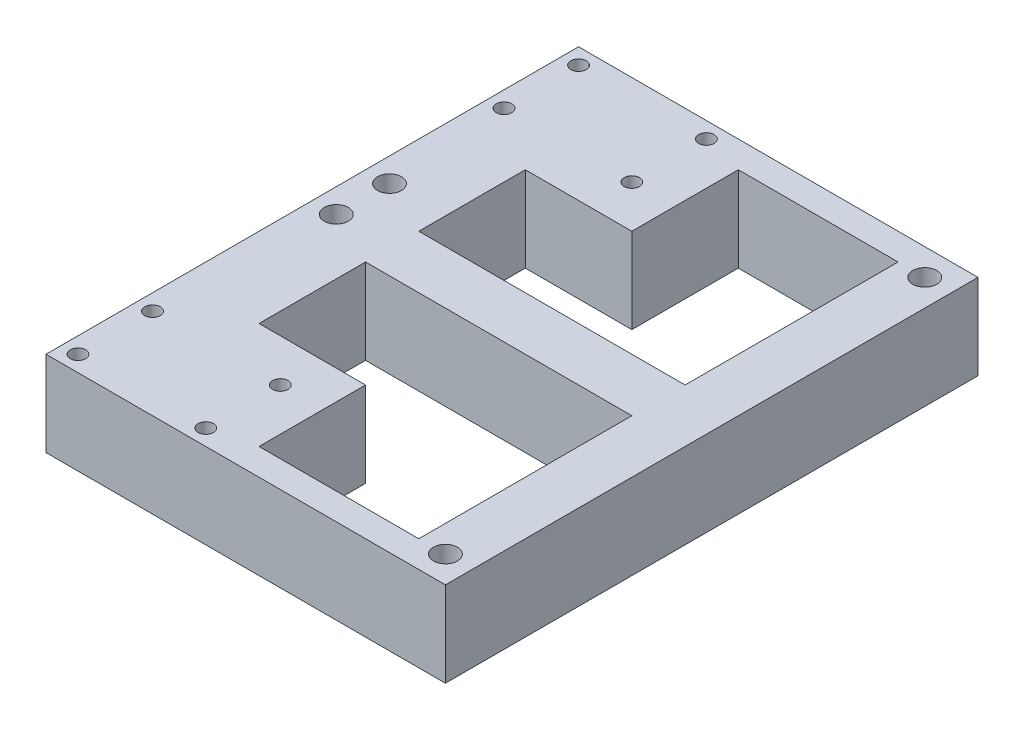
from build123d import *

# Parameters (mm, degrees)
SKETCH_1_W           = 75
SKETCH_1_H           = 100
EXTRUDE_1_DEPTH      = 16
CUT_EXTRUDE_5_REACH  = 128.02
SKETCH_8_R           = 1.45
CUT_EXTRUDE_7_DEPTH  = 127.019839708
SKETCH_9_W           = 40
SKETCH_9_H           = 16
EXTRUDE_2_DEPTH      = 5
SKETCH_10_R          = 2.25
CUT_EXTRUDE_8_DEPTH  = 5
CUT_EXTRUDE_START    = -5
SKETCH_11_R          = 2.25
CUT_EXTRUDE_9_DEPTH  = 5
SKETCH_12_W          = 20
SKETCH_12_H          = 16
EXTRUDE_3_DEPTH      = 10
SKETCH_13_R          = 2.25
CUT_EXTRUDE_10_DEPTH = 5


with BuildPart() as part:
    # 草图1 → 凸台-拉伸1 (new body)
    with BuildSketch(Plane(origin=(0, 0, 0), x_dir=(1, 0, 0), z_dir=(0, 1, 0))):
        with Locations((-37.5, 50)):
            Rectangle(SKETCH_1_W, SKETCH_1_H)
    extrude(amount=EXTRUDE_1_DEPTH)

    # 草图6 → 切除-拉伸5 (cut, up to next)
    with BuildSketch(Plane(origin=(0, 16, 0), x_dir=(1, 0, 0), z_dir=(0, 1, 0)), mode=Mode.PRIVATE) as cut_extrude_5_sk1:
        Polygon((-40, 45), (-5, 45), (-5, 5), (-40, 5), (-40, 25), (-70, 25), (-70, 45), align=None)
    cut_extrude_5_tool1 = extrude(cut_extrude_5_sk1.sketch, amount=-CUT_EXTRUDE_5_REACH, mode=Mode.PRIVATE) & part.part
    # 草图6 → 切除-拉伸5 (cut, up to next)
    with BuildSketch(Plane(origin=(0, 16, 0), x_dir=(1, 0, 0), z_dir=(0, 1, 0)), mode=Mode.PRIVATE) as cut_extrude_5_sk2:
        Polygon((-40, 95), (-5, 95), (-5, 55), (-40, 55), (-70, 55), (-70, 75), (-40, 75), align=None)
    cut_extrude_5_tool2 = extrude(cut_extrude_5_sk2.sketch, amount=-CUT_EXTRUDE_5_REACH, mode=Mode.PRIVATE) & part.part
    add(cut_extrude_5_tool1.solids().sort_by_distance((-32.25, 16, -28))[0], mode=Mode.SUBTRACT)
    add(cut_extrude_5_tool2.solids().sort_by_distance((-32.25, 16, -72))[0], mode=Mode.SUBTRACT)

    # 草图8 → 切除-拉伸7 (cut, through all)
    with BuildSketch(Plane(origin=(0, 16, 0), x_dir=(1, 0, 0), z_dir=(0, 1, 0))):
        with Locations((-72, 97)):
            Circle(SKETCH_8_R)
        with Locations((-72, 83)):
            Circle(SKETCH_8_R)
        with Locations((-48, 97)):
            Circle(SKETCH_8_R)
        with Locations((-48, 83)):
            Circle(SKETCH_8_R)
        with Locations((-48, 17)):
            Circle(SKETCH_8_R)
        with Locations((-48, 3)):
            Circle(SKETCH_8_R)
        with Locations((-72, 17)):
            Circle(SKETCH_8_R)
        with Locations((-72, 3)):
            Circle(SKETCH_8_R)
    extrude(amount=-CUT_EXTRUDE_7_DEPTH, mode=Mode.SUBTRACT)

    # 草图9 → 凸台-拉伸2 (add)
    with BuildSketch(Plane.ZY.offset(5)):
        with Locations((-25, 8)):
            Rectangle(SKETCH_9_W, SKETCH_9_H)
        with Locations((-75, 8)):
            Rectangle(SKETCH_9_W, SKETCH_9_H)
    extrude(amount=EXTRUDE_2_DEPTH)

    # 草图10 → 切除-拉伸8 (cut)
    with BuildSketch(Plane(origin=(0, 16, 0), x_dir=(1, 0, 0), z_dir=(0, 1, 0))):
        with Locations((-5, 95)):
            Circle(SKETCH_10_R)
        with Locations((-5, 5)):
            Circle(SKETCH_10_R)
    extrude(amount=-CUT_EXTRUDE_8_DEPTH, mode=Mode.SUBTRACT)

    # 草图11 → 切除-拉伸9 (cut)
    with BuildSketch(Plane.XZ.offset(CUT_EXTRUDE_START)):
        with Locations((-5, -95)):
            Circle(SKETCH_11_R)
        with Locations((-5, -5)):
            Circle(SKETCH_11_R)
    extrude(amount=CUT_EXTRUDE_9_DEPTH, mode=Mode.SUBTRACT)

    # 草图12 → 凸台-拉伸3 (add)
    with BuildSketch(Plane(origin=(-70, 0, 0), x_dir=(0, 0, -1), z_dir=(1, 0, 0))):
        with Locations((35, 8)):
            Rectangle(SKETCH_12_W, SKETCH_12_H)
        with Locations((65, 8)):
            Rectangle(SKETCH_12_W, SKETCH_12_H)
    extrude(amount=EXTRUDE_3_DEPTH)

    # 草图13 → 切除-拉伸10 (cut)
    with BuildSketch(Plane(origin=(0, 16, 0), x_dir=(1, 0, 0), z_dir=(0, 1, 0))):
        with Locations((-70.5, 50)):
            Circle(SKETCH_13_R)
        with Locations((-70.5, 60)):
            Circle(SKETCH_13_R)
    extrude(amount=-CUT_EXTRUDE_10_DEPTH, mode=Mode.SUBTRACT)


solid = part.part
